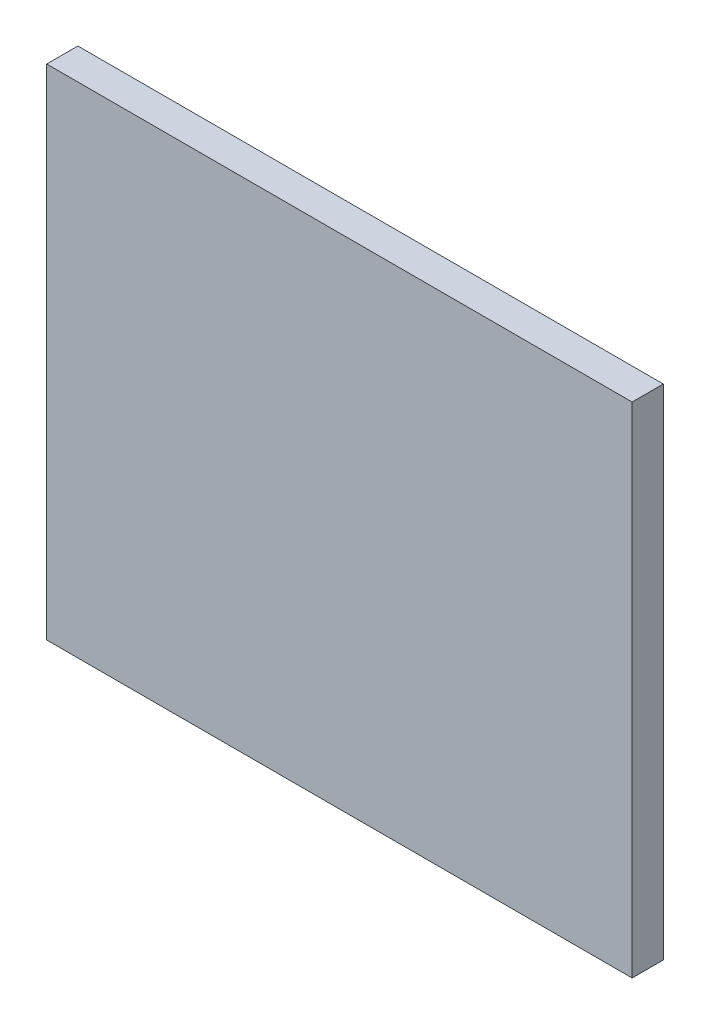
from build123d import *

# Parameters (mm, degrees)
SKETCH1_W           = 84.5
SKETCH1_H           = 72
BOSS_EXTRUDE1_DEPTH = 4.5


with BuildPart() as part:
    # Sketch1 → Boss-Extrude1 (new body)
    with BuildSketch(Plane.XY):
        Rectangle(SKETCH1_W, SKETCH1_H)
    extrude(amount=BOSS_EXTRUDE1_DEPTH)


solid = part.part
